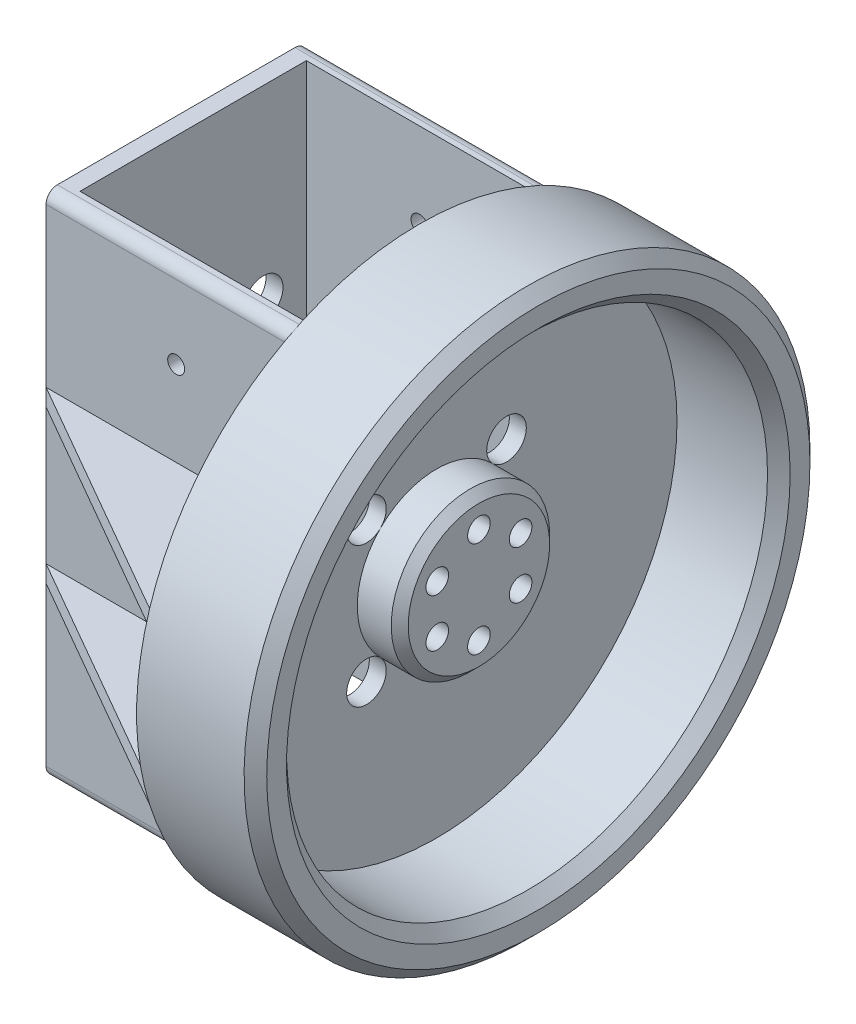
from build123d import *

# Parameters (mm, degrees)
ESQUISSE3_R                  = 50
ESQUISSE3_R_2                = 42.5
BOSS_EXTRU_2_DEPTH           = 18
BOSS_EXTRU_3_START           = 3
ESQUISSE4_R                  = 50
BOSS_EXTRU_3_DEPTH           = 3
ESQUISSE5_R                  = 14
BOSS_EXTRU_4_DEPTH           = 7.5
BOSS_EXTRU_5_DEPTH           = 45
BOSS_EXTRU_5_DEPTH_BACK      = 45
CONG_1_R                     = 2
ESQUISSE6_R                  = 3.5
ENL_V_MAT_EXTRU_1_DEPTH      = 85.356386836
ESQUISSE7_R                  = 2
ENL_V_MAT_EXTRU_2_DEPTH      = 89.669329534
ENL_V_MAT_EXTRU_3_DEPTH      = 83.758685345
ENL_V_MAT_EXTRU_3_DEPTH_BACK = 4
ESQUISSE8_R                  = 3.5
ESQUISSE11_W                 = 24.696960071
ESQUISSE11_H                 = 3
BOSS_EXTRU_6_DEPTH           = 43
ENL_V_MAT_EXTRU_4_DEPTH      = 43
ESQUISSE13_R                 = 1.5
ENL_V_MAT_EXTRU_5_DEPTH      = 100.724620832
CHANFREIN1_SIZE              = 2
CHANFREIN2_SIZE              = 1.5


with BuildPart() as part:
    # Esquisse3 → Boss.-Extru.2 (new body)
    with BuildSketch(Plane(origin=(0, 0, 0), x_dir=(0, 0, -1), z_dir=(1, 0, 0))):
        Circle(ESQUISSE3_R)
        Circle(ESQUISSE3_R_2, mode=Mode.SUBTRACT)
    extrude(amount=BOSS_EXTRU_2_DEPTH)

    # Esquisse4 → Boss.-Extru.3 (add)
    with BuildSketch(Plane.ZY.offset(BOSS_EXTRU_3_START)):
        Circle(ESQUISSE4_R)
    extrude(amount=-BOSS_EXTRU_3_DEPTH)

    # Esquisse5 → Boss.-Extru.4 (add)
    with BuildSketch(Plane(origin=(0, 0, 0), x_dir=(0, 0, -1), z_dir=(1, 0, 0))):
        with Locations(Location((0, 0, 0), (0, 0, 180))):
            Circle(ESQUISSE5_R)
    extrude(amount=BOSS_EXTRU_4_DEPTH)

    # Esquisse10 → Boss.-Extru.5 (add, two sides: drawn at the far end of the back side and taken through both)
    with BuildSketch(Plane(origin=(0, 0, 0), x_dir=(1, 0, 0), z_dir=(0, 1, 0)).offset(-BOSS_EXTRU_5_DEPTH_BACK)):
        Polygon((-46, 23), (-3, 23), (-3, 20), (-43, 20), (-43, -20), (-3, -20), (-3, -23), (-46, -23), align=None)
    extrude(amount=BOSS_EXTRU_5_DEPTH + BOSS_EXTRU_5_DEPTH_BACK)

    # Congé1
    # the kernel refuses this fillet: 2 mm, written as the material it takes off along each edge
    with BuildSketch(Plane(origin=(-51, -45, -23), x_dir=(0, 0, 1), z_dir=(1, 0, 0)), Plane(origin=(-3, 45, 23), x_dir=(0, -1, 0), z_dir=(-1, 0, 0))) as cong_1_piece_1:
        with BuildLine():
            CenterArc((CONG_1_R, -CONG_1_R), CONG_1_R, 90, 90)
            Line((0, -CONG_1_R), (0, 0))
            Line((0, 0), (CONG_1_R, 0))
        make_face()
    extrude(amount=48, mode=Mode.SUBTRACT)
    with BuildSketch(Plane(origin=(-3, -45, 23), x_dir=(0, 1, 0), z_dir=(-1, 0, 0)), Plane(origin=(-51, 45, -23), x_dir=(0, 0, 1), z_dir=(1, 0, 0))) as cong_1_piece_2:
        with BuildLine():
            CenterArc((CONG_1_R, CONG_1_R), CONG_1_R, 180, 90)
            Line((0, CONG_1_R), (0, 0))
            Line((0, 0), (CONG_1_R, 0))
        make_face()
    extrude(amount=48, mode=Mode.SUBTRACT)

    # Esquisse6 → Enlèv. mat.-Extru.1 (cut, through all)
    with BuildSketch(Plane(origin=(0, 0, 0), x_dir=(0, 0, -1), z_dir=(1, 0, 0))):
        with Locations((-12.374368671, 12.374368671)):
            Circle(ESQUISSE6_R)
        with Locations((12.374368671, 12.374368671)):
            Circle(ESQUISSE6_R)
        with Locations((12.374368671, -12.374368671)):
            Circle(ESQUISSE6_R)
        with Locations((-12.374368671, -12.374368671)):
            Circle(ESQUISSE6_R)
    extrude(amount=-ENL_V_MAT_EXTRU_1_DEPTH, mode=Mode.SUBTRACT)

    # Esquisse7 → Enlèv. mat.-Extru.2 (cut, through all)
    with BuildSketch(Plane(origin=(7.5, 0, 0), x_dir=(0, 0, -1), z_dir=(1, 0, 0))):
        with Locations((0, 8.5)):
            Circle(ESQUISSE7_R)
        with Locations((7.361215932, 4.25)):
            Circle(ESQUISSE7_R)
        with Locations((7.361215932, -4.25)):
            Circle(ESQUISSE7_R)
        with Locations((0, -8.5)):
            Circle(ESQUISSE7_R)
        with Locations((-7.361215932, -4.25)):
            Circle(ESQUISSE7_R)
        with Locations((-7.361215932, 4.25)):
            Circle(ESQUISSE7_R)
    extrude(amount=-ENL_V_MAT_EXTRU_2_DEPTH, mode=Mode.SUBTRACT)

    # Esquisse8 → Enlèv. mat.-Extru.3 (cut, two sides: drawn at the far end of the back side and taken through both)
    with BuildSketch(Plane.ZY.offset(3).offset(-ENL_V_MAT_EXTRU_3_DEPTH_BACK)):
        with Locations((0, -8.5)):
            Circle(ESQUISSE8_R)
        with Locations((7.361215932, -4.25)):
            Circle(ESQUISSE8_R)
        with Locations((0, 8.5)):
            Circle(ESQUISSE8_R)
        with Locations((7.361215932, 4.25)):
            Circle(ESQUISSE8_R)
        with Locations((-7.361215932, -4.25)):
            Circle(ESQUISSE8_R)
        with Locations((-7.361215932, 4.25)):
            Circle(ESQUISSE8_R)
    extrude(amount=ENL_V_MAT_EXTRU_3_DEPTH + ENL_V_MAT_EXTRU_3_DEPTH_BACK, mode=Mode.SUBTRACT)

    # Esquisse11 → Boss.-Extru.6 (add)
    with BuildSketch(Plane.ZY.offset(3)):
        with Locations((35.348480036, 13.5)):
            Rectangle(ESQUISSE11_W, ESQUISSE11_H)
        with Locations((35.348480036, -13.5)):
            Rectangle(ESQUISSE11_W, ESQUISSE11_H)
        with Locations((-35.348480036, -13.5)):
            Rectangle(ESQUISSE11_W, ESQUISSE11_H)
        with Locations((-35.348480036, 13.5)):
            Rectangle(ESQUISSE11_W, ESQUISSE11_H)
    extrude(amount=BOSS_EXTRU_6_DEPTH)

    # Esquisse12 → Enlèv. mat.-Extru.4 (cut)
    with BuildSketch(Plane.XZ.offset(15)):
        Polygon((-46, -23), (-3, -47.696960071), (-46, -47.696960071), align=None)
        Polygon((-46, 23), (-3, 47.696960071), (-46, 47.696960071), align=None)
    extrude(amount=-ENL_V_MAT_EXTRU_4_DEPTH, mode=Mode.SUBTRACT)

    # Esquisse13 → Enlèv. mat.-Extru.5 (cut, through all)
    with BuildSketch(Plane(origin=(0, 0, -23), x_dir=(-1, 0, 0), z_dir=(0, 0, -1))):
        with Locations((23, 30)):
            Circle(ESQUISSE13_R)
        with Locations((23, -30)):
            Circle(ESQUISSE13_R)
        with Locations((23, 0)):
            Circle(ESQUISSE13_R)
    extrude(amount=-ENL_V_MAT_EXTRU_5_DEPTH, mode=Mode.SUBTRACT)

    # Chanfrein1
    chanfrein1_edges = [part.edges().sort_by_distance(p)[0] for p in [
        (18, 0, 50),
        (18, 0, 42.5),
    ]]
    chamfer(chanfrein1_edges, length=CHANFREIN1_SIZE)

    # Chanfrein2
    chanfrein2_edges = [part.edges().sort_by_distance(p)[0] for p in [
        (7.5, 0, -14),
    ]]
    chamfer(chanfrein2_edges, length=CHANFREIN2_SIZE)


solid = part.part
